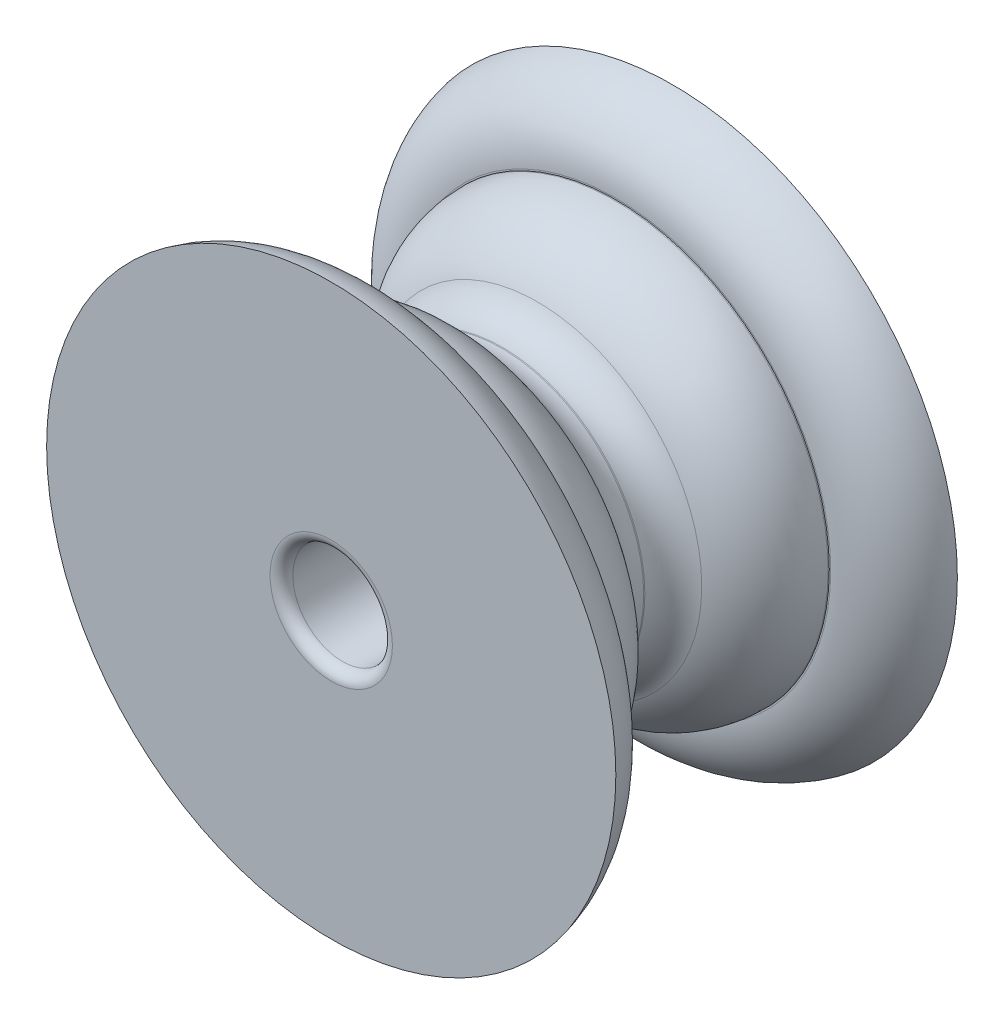
from build123d import *

# Parameters (mm, degrees)
SKETCH_1_R          = 10
EXTRUDE_1_DEPTH     = 2
SKETCH_2_R          = 7.5
EXTRUDE_2_DEPTH     = 3
SKETCH_3_R          = 5
EXTRUDE_3_DEPTH     = 2
SKETCH_4_R          = 7.5
EXTRUDE_4_DEPTH     = 3
SKETCH_5_R          = 10
EXTRUDE_5_DEPTH     = 2
SKETCH_6_R          = 1.75
CUT_EXTRUDE_1_DEPTH = 22
FILLET_1_R          = 3
FILLET_3_R          = 1.35
FILLET_4_R          = 0.4
FILLET_5_R          = 2.5


with BuildPart() as part:
    # 草图1 → 凸台-拉伸1 (new body)
    with BuildSketch(Plane.XY):
        Circle(SKETCH_1_R)
    extrude(amount=EXTRUDE_1_DEPTH)

    # 草图2 → 凸台-拉伸2 (add)
    with BuildSketch(Plane.XY.offset(2)):
        Circle(SKETCH_2_R)
    extrude(amount=EXTRUDE_2_DEPTH)

    # 草图3 → 凸台-拉伸3 (add)
    with BuildSketch(Plane.XY.offset(5)):
        Circle(SKETCH_3_R)
    extrude(amount=EXTRUDE_3_DEPTH)

    # 草图4 → 凸台-拉伸4 (add)
    with BuildSketch(Plane.XY.offset(7)):
        Circle(SKETCH_4_R)
    extrude(amount=EXTRUDE_4_DEPTH)

    # 草图5 → 凸台-拉伸5 (add)
    with BuildSketch(Plane.XY.offset(10)):
        Circle(SKETCH_5_R)
    extrude(amount=EXTRUDE_5_DEPTH)

    # 草图6 → 切除-拉伸1 (cut)
    with BuildSketch(Plane(origin=(0, 0, 0), x_dir=(-1, 0, 0), z_dir=(0, 0, -1))):
        Circle(SKETCH_6_R)
    extrude(amount=-CUT_EXTRUDE_1_DEPTH, mode=Mode.SUBTRACT)

    # 圆角1
    # the kernel refuses this fillet: 3 mm, written as the material it takes off along each edge
    with BuildSketch(Plane(origin=(0, 0, 7), x_dir=(1, 0, 0), z_dir=(0, -1, 0))) as fillet_1_piece_1:
        with BuildLine():
            CenterArc((4.5, 2.958039892), FILLET_1_R, 279.594068227, 80.405931773)
            Line((5, 0), (5.01, -0.059160798))
            ThreePointArc((5.01, -0.059160798), (6.25, -0.06), (7.5, -0.06))
            Line((7.5, -0.06), (7.56, 0))
            Line((7.56, 0), (7.56, 2.958039892))
            Line((7.56, 2.958039892), (7.5, 2.958039892))
        make_face()
    revolve(axis=Axis((0, 0, 7), (0, 0, 1)), mode=Mode.SUBTRACT)
    with BuildSketch(Plane(origin=(0, 0, 5), x_dir=(1, 0, 0), z_dir=(0, -1, 0))) as fillet_1_piece_2:
        with BuildLine():
            CenterArc((4.5, -2.958039892), FILLET_1_R, 0, 80.405931773)
            Line((7.5, -2.958039892), (7.56, -2.958039892))
            Line((7.56, -2.958039892), (7.56, 0))
            Line((7.56, 0), (7.5, 0.06))
            ThreePointArc((7.5, 0.06), (6.25, 0.06), (5.01, 0.059160798))
            Line((5.01, 0.059160798), (5, 0))
        make_face()
    revolve(axis=Axis((0, 0, 5), (0, 0, 1)), mode=Mode.SUBTRACT)

    # 圆角3
    fillet_3_edges = [part.edges().sort_by_distance(p)[0] for p in [
        (-5, 0, 7),
        (-5, 0, 5),
    ]]
    fillet(fillet_3_edges, radius=FILLET_3_R)

    # 圆角4
    fillet_4_edges = [part.edges().sort_by_distance(p)[0] for p in [
        (1.75, 0, 12),
        (1.75, 0, 0),
    ]]
    fillet(fillet_4_edges, radius=FILLET_4_R)

    # 圆角5
    # the kernel refuses this fillet: 2.5 mm, written as the material it takes off along each edge
    with BuildSketch(Plane(origin=(0, 0, 10), x_dir=(1, 0, 0), z_dir=(0, -1, 0))) as fillet_5_piece_1:
        with BuildLine():
            CenterArc((7.550510257, 2.5), FILLET_5_R, 270, 78.463040967)
            Line((7.550510257, 0), (7.550510257, -0.05))
            Line((7.550510257, -0.05), (10, -0.05))
            Line((10, -0.05), (10.05, 0))
            ThreePointArc((10.05, 0), (10.05, 1), (10.048989795, 1.99))
            Line((10.048989795, 1.99), (10, 2))
        make_face()
    revolve(axis=Axis((0, 0, 10), (0, 0, 1)), mode=Mode.SUBTRACT)
    with BuildSketch(Plane(origin=(0, 0, 2), x_dir=(1, 0, 0), z_dir=(0, -1, 0))) as fillet_5_piece_2:
        with BuildLine():
            CenterArc((7.550510257, -2.5), FILLET_5_R, 11.536959033, 78.463040967)
            Line((7.550510257, 0), (7.550510257, 0.05))
            Line((7.550510257, 0.05), (10, 0.05))
            Line((10, 0.05), (10.05, 0))
            ThreePointArc((10.05, 0), (10.05, -1), (10.048989795, -1.99))
            Line((10.048989795, -1.99), (10, -2))
        make_face()
    revolve(axis=Axis((0, 0, 2), (0, 0, 1)), mode=Mode.SUBTRACT)


solid = part.part
